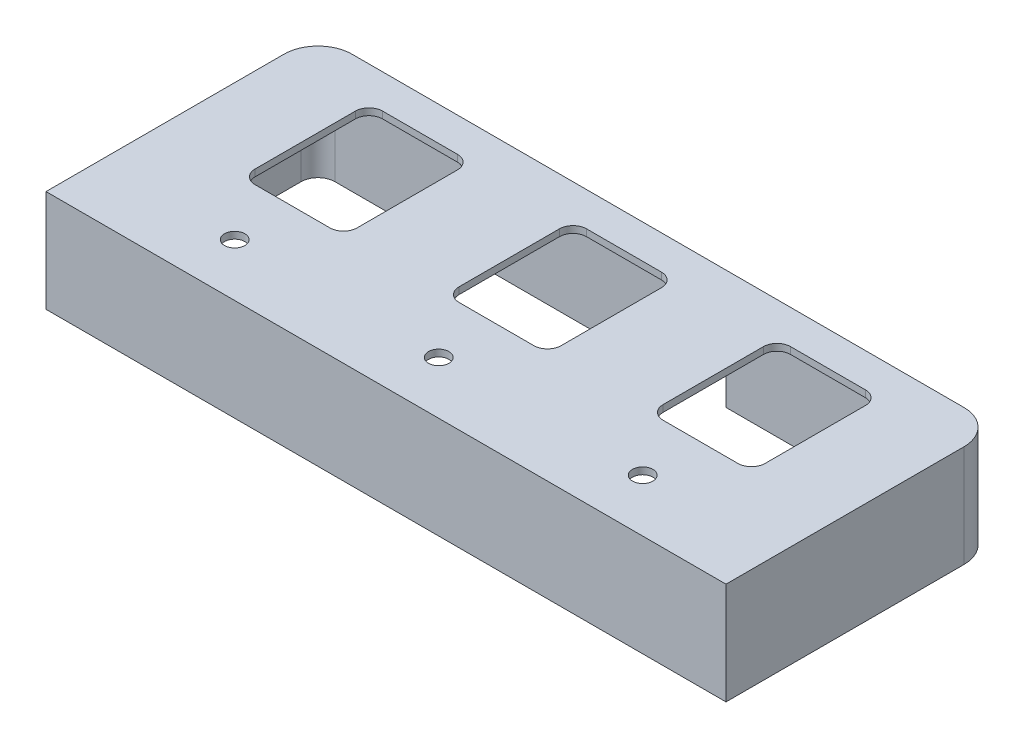
from build123d import *

# Parameters (mm, degrees)
SKETCH_1134_R          = 3
EXTRUDE_1148_DEPTH     = 2
EXTRUDE_1201_DEPTH     = 30
SKETCH_1280_W          = 30
SKETCH_1280_H          = 5
CUT_EXTRUDE_1384_DEPTH = 10


with BuildPart() as part:
    # Sketch 1134 → Extrude 1148 (new body)
    with BuildSketch(Plane(origin=(0, 0, 0), x_dir=(1, 0, 0), z_dir=(0, 1, 0))):
        with BuildLine():
            Line((-90, 40), (90, 40))
            ThreePointArc((90, 40), (97.071067812, 37.071067812), (100, 30))
            Line((100, 30), (100, -40))
            Line((100, -40), (-100, -40))
            Line((-100, -40), (-100, 30))
            ThreePointArc((-100, 30), (-97.071067812, 37.071067812), (-90, 40))
        make_face()
        with Locations((60, -24.5)):
            Circle(SKETCH_1134_R, mode=Mode.SUBTRACT)
        with Locations((0, -24.5)):
            Circle(SKETCH_1134_R, mode=Mode.SUBTRACT)
        with Locations((-60, -24.5)):
            Circle(SKETCH_1134_R, mode=Mode.SUBTRACT)
        with BuildLine():
            Line((49, 30), (71, 30))
            ThreePointArc((71, 30), (73.828427125, 28.828427125), (75, 26))
            Line((75, 26), (75, -3.5))
            ThreePointArc((75, -3.5), (73.828427125, -6.328427125), (71, -7.5))
            Line((71, -7.5), (49, -7.5))
            ThreePointArc((49, -7.5), (46.171572875, -6.328427125), (45, -3.5))
            Line((45, -3.5), (45, 26))
            ThreePointArc((45, 26), (46.171572875, 28.828427125), (49, 30))
        make_face(mode=Mode.SUBTRACT)
        with BuildLine():
            Line((-11, 30), (11, 30))
            ThreePointArc((11, 30), (13.828427125, 28.828427125), (15, 26))
            Line((15, 26), (15, -3.5))
            ThreePointArc((15, -3.5), (13.828427125, -6.328427125), (11, -7.5))
            Line((11, -7.5), (-11, -7.5))
            ThreePointArc((-11, -7.5), (-13.828427125, -6.328427125), (-15, -3.5))
            Line((-15, -3.5), (-15, 26))
            ThreePointArc((-15, 26), (-13.828427125, 28.828427125), (-11, 30))
        make_face(mode=Mode.SUBTRACT)
        with BuildLine():
            Line((-71, 30), (-49, 30))
            ThreePointArc((-49, 30), (-46.171572875, 28.828427125), (-45, 26))
            Line((-45, 26), (-45, -3.5))
            ThreePointArc((-45, -3.5), (-46.171572875, -6.328427125), (-49, -7.5))
            Line((-49, -7.5), (-71, -7.5))
            ThreePointArc((-71, -7.5), (-73.828427125, -6.328427125), (-75, -3.5))
            Line((-75, -3.5), (-75, 26))
            ThreePointArc((-75, 26), (-73.828427125, 28.828427125), (-71, 30))
        make_face(mode=Mode.SUBTRACT)
    extrude(amount=-EXTRUDE_1148_DEPTH)

    # Sketch 1194 → Extrude 1201 (add)
    with BuildSketch(Plane(origin=(0, 0, 0), x_dir=(1, 0, 0), z_dir=(0, 1, 0))):
        with BuildLine():
            Line((-90, 40), (90, 40))
            ThreePointArc((90, 40), (97.071067812, 37.071067812), (100, 30))
            Line((100, 30), (100, -40))
            Line((100, -40), (-100, -40))
            Line((-100, -40), (-100, 30))
            ThreePointArc((-100, 30), (-97.071067812, 37.071067812), (-90, 40))
        make_face()
        with BuildLine():
            Line((-90, 35), (90, 35))
            ThreePointArc((90, 35), (93.535533906, 33.535533906), (95, 30))
            Line((95, 30), (95, -35))
            Line((95, -35), (-95, -35))
            Line((-95, -35), (-95, 30))
            ThreePointArc((-95, 30), (-93.535533906, 33.535533906), (-90, 35))
        make_face(mode=Mode.SUBTRACT)
    extrude(amount=-EXTRUDE_1201_DEPTH)

    # Sketch 1280 → Cut-Extrude 1384 (cut)
    with BuildSketch(Plane(origin=(0, -30, 0), x_dir=(1, 0, 0), z_dir=(0, 1, 0))):
        with Locations((10, 37.5)):
            Rectangle(SKETCH_1280_W, SKETCH_1280_H)
    extrude(amount=CUT_EXTRUDE_1384_DEPTH, mode=Mode.SUBTRACT)


solid = part.part
